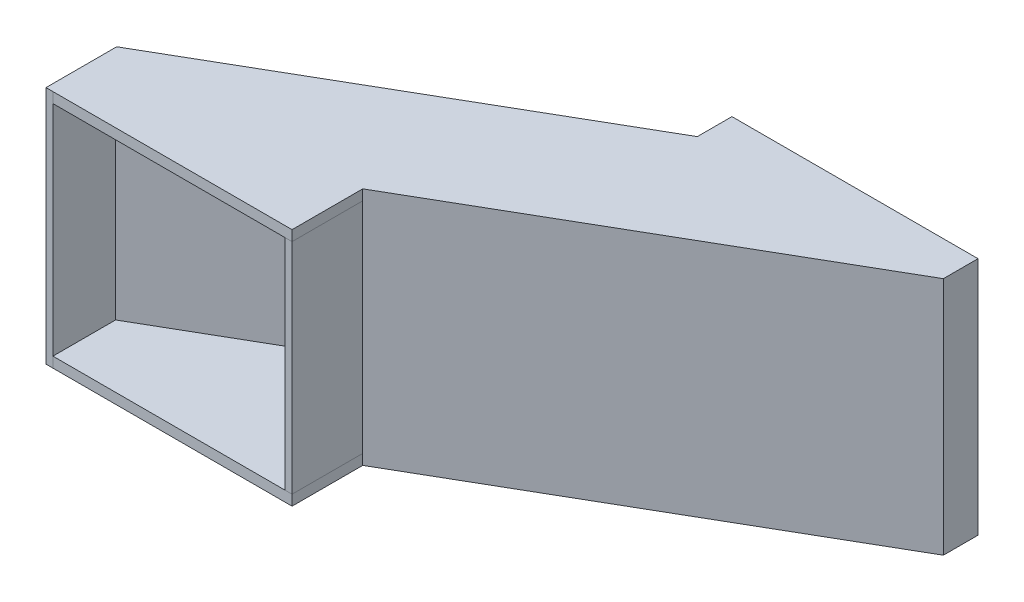
from build123d import *

# Parameters (mm, degrees)
SKETCH1_W            = 71.049193282
SKETCH1_H            = 69.159838322
SKETCH1_W_2          = 65.049193282
SKETCH1_H_2          = 63.159838322
BOSS_EXTRUDE1_DEPTH  = 10
BOSS_EXTRUDE2_DEPTH  = 3
BOSS_EXTRUDE3_DEPTH  = 3
SKETCH4_W            = 122.733728081
SKETCH4_H            = 69.159838322
BOSS_EXTRUDE5_DEPTH  = 3
SKETCH5_W            = 122.734426718
SKETCH5_H            = 63.159838322
BOSS_EXTRUDE14_DEPTH = 3
SKETCH6_W            = 20.406171659
SKETCH6_H            = 63.159838322
BASE_FLANGE1_DEPTH   = 2
SKETCH11_W           = 20.40582234
SKETCH11_H           = 69.159838322
BASE_FLANGE2_DEPTH   = 2


# Sheet-metal steps are written as plain solids
with BuildPart() as part:
    # Sketch1 → Boss-Extrude1 (new body)
    with BuildSketch(Plane.XY):
        Rectangle(SKETCH1_W, SKETCH1_H)
        Rectangle(SKETCH1_W_2, SKETCH1_H_2, mode=Mode.SUBTRACT)
    extrude(amount=BOSS_EXTRUDE1_DEPTH)

    # Sketch2 → Boss-Extrude2 (add)
    with BuildSketch(Plane.XZ.offset(34.579919161)):
        Polygon((35.524596641, 10), (-70.765929778, 71.36686404), (-70.765929778, 91.773035699), (-141.815929778, 91.773035699), (-141.815728099, 71.367213359), (-35.524596641, 10), align=None)
    extrude(amount=-BOSS_EXTRUDE2_DEPTH)

    # Sketch3 → Boss-Extrude3 (add)
    with BuildSketch(Plane(origin=(0, 34.579919161, 0), x_dir=(1, 0, 0), z_dir=(0, 1, 0))):
        Polygon((-35.524596641, -10), (-141.815728099, -71.367213359), (-141.815929778, -91.773035699), (-70.765929778, -91.773035699), (-70.765929778, -71.36686404), (35.524596641, -10), align=None)
    extrude(amount=-BOSS_EXTRUDE3_DEPTH)

    # Sketch4 → Boss-Extrude5 (add)
    with BuildSketch(Plane(origin=(13.211276179, 0, 22.882601575), x_dir=(0.8660254037844416, 0, -0.499999999999995), z_dir=(0.49999999999999495, 0, 0.8660254037844415))):
        with Locations((-35.601660889, 0)):
            Rectangle(SKETCH4_W, SKETCH4_H)
    extrude(amount=-BOSS_EXTRUDE5_DEPTH)


with BuildPart() as body_2:
    # Sketch5 → Boss-Extrude14 (new body)
    with BuildSketch(Plane(origin=(-4.551022141, 0, -7.882601575), x_dir=(-0.8660254037844417, 0, 0.49999999999999467), z_dir=(-0.49999999999999467, 0, -0.8660254037844417))):
        with Locations((97.13241651, 0)):
            Rectangle(SKETCH5_W, SKETCH5_H)
    extrude(amount=-BOSS_EXTRUDE14_DEPTH)


with BuildPart() as body_3:
    # Sketch6 → Base-Flange1 (new body)
    with BuildSketch(Plane(origin=(-70.765929778, 0, 0), x_dir=(0, 0, -1), z_dir=(1, 0, 0))):
        with Locations((-81.56994987, 0)):
            Rectangle(SKETCH6_W, SKETCH6_H)
    extrude(amount=-BASE_FLANGE1_DEPTH)


with BuildPart() as body_4:
    # Sketch11 → Base-Flange2 (new body)
    with BuildSketch(Plane(origin=(-141.815022732, 0, -0.001401618), x_dir=(-9.883423150445956e-06, 0, 0.9999999999511591), z_dir=(-0.9999999999511591, 0, -9.883423150445956e-06))):
        with Locations((81.571526151, 0)):
            Rectangle(SKETCH11_W, SKETCH11_H)
    extrude(amount=-BASE_FLANGE2_DEPTH)


solid = Compound([part.part, body_2.part, body_3.part, body_4.part])
